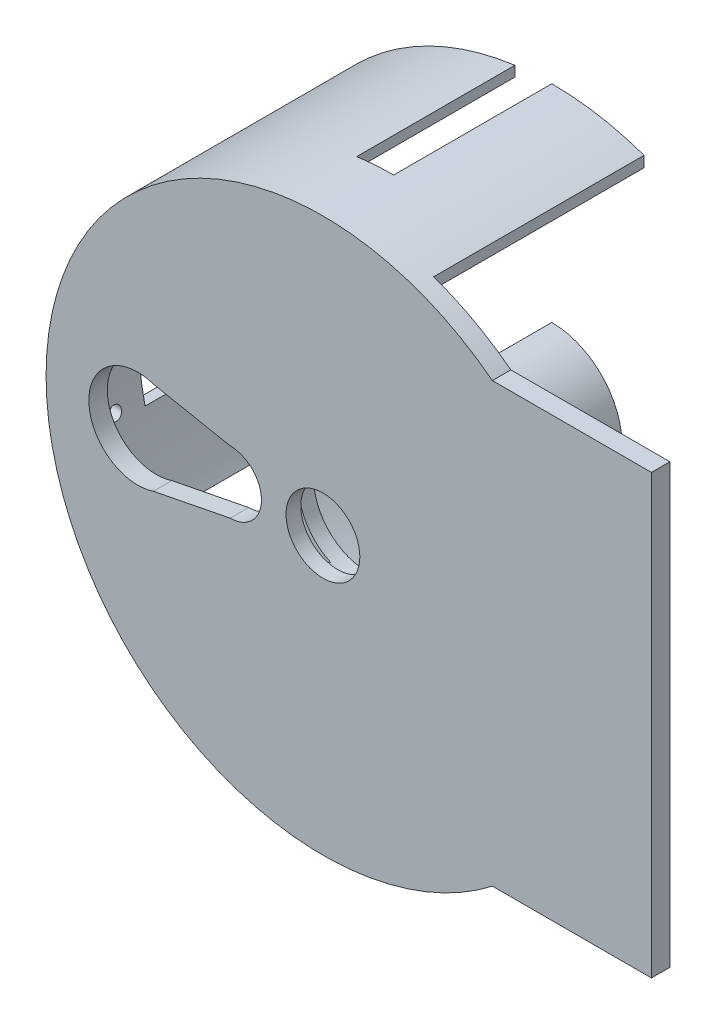
from build123d import *
from build123d.topology import SkipClean

# Parameters (mm, degrees)
SKETCH1_R                = 75
BOSS_EXTRUDE1_DEPTH      = 52
BOSS_EXTRUDE2_DEPTH      = 89
SKETCH6_R                = 67.5
CUT_EXTRUDE1_DEPTH       = 40
SKETCH7_R                = 10
CUT_EXTRUDE2_DEPTH       = 140
BOSS_EXTRUDE3_DEPTH      = 50
SKETCH27_R               = 13.264650289
SKETCH27_R_2             = 8.484923144
CUT_EXTRUDE7_DEPTH       = 32
SKETCH28_W               = 110.347797284
SKETCH28_H               = 32
CUT_EXTRUDE9_DEPTH       = 112
SKETCH30_R               = 1.75
CUT_EXTRUDE10_DEPTH      = 10
SKETCH31_W               = 17.16689537
SKETCH31_H               = 79.570672492
CUT_EXTRUDE11_DEPTH      = 7
SKETCH32_W               = 3
SKETCH32_H               = 75.570672492
CUT_EXTRUDE12_DEPTH      = 8.6
CUT_EXTRUDE13_START      = -8
SKETCH34_R               = 14.5
CUT_EXTRUDE13_DEPTH      = 8
BOSS_EXTRUDE4_START      = 10
SKETCH35_R               = 75
SKETCH35_R_2             = 67.5
BOSS_EXTRUDE4_DEPTH      = 10
SKETCH37_R               = 72.25
SKETCH37_R_2             = 67.5
CUT_EXTRUDE15_DEPTH      = 50
CUT_EXTRUDE16_DEPTH      = 7
CUT_EXTRUDE17_DEPTH      = 7
CUT_EXTRUDE19_REACH      = 184.003
CUT_EXTRUDE19_END_RADIUS = 72.25
SKETCH42_W               = 10
SKETCH42_H               = 42.845008339
CIRPATTERN1_COUNT        = 5
CIRPATTERN1_ANGLE        = 180
CIRPATTERN2_COUNT        = 3
CIRPATTERN2_ANGLE        = 120
CUT_EXTRUDE20_DEPTH      = 10
SKETCH44_W               = 50
SKETCH44_H               = 57
CUT_EXTRUDE21_DEPTH      = 183.002747343


with BuildPart() as part:
    # Sketch1 → Boss-Extrude1 (new body)
    with BuildSketch(Plane.XY):
        Circle(SKETCH1_R)
    extrude(amount=BOSS_EXTRUDE1_DEPTH)

    # Sketch5 → Boss-Extrude2 (add)
    with BuildSketch(Plane(origin=(0, 0, 0), x_dir=(0, 0, -1), z_dir=(1, 0, 0))):
        Polygon((-52, 59.314332163), (-52, 0), (-52, -59.3), (-47, -59.3), (-47, 59.314332163), align=None)
    extrude(amount=BOSS_EXTRUDE2_DEPTH)

    # Sketch6 → Cut-Extrude1 (cut)
    with BuildSketch(Plane(origin=(0, 0, 0), x_dir=(-1, 0, 0), z_dir=(0, 0, -1))):
        Circle(SKETCH6_R)
    extrude(amount=-CUT_EXTRUDE1_DEPTH, mode=Mode.SUBTRACT)

    # Sketch7 → Cut-Extrude2 (cut)
    with BuildSketch(Plane(origin=(0, 0, 40), x_dir=(-1, 0, 0), z_dir=(0, 0, -1))):
        Circle(SKETCH7_R)
    extrude(amount=-CUT_EXTRUDE2_DEPTH, mode=Mode.SUBTRACT)

    # Sketch8 → Boss-Extrude3 (add)
    with BuildSketch(Plane(origin=(0, 0, 40), x_dir=(-1, 0, 0), z_dir=(0, 0, -1))):
        with BuildLine():
            Line((0, 14.5), (0, 19))
            ThreePointArc((0, 19), (-19, 0), (0, -19))
            Line((0, -19), (0, -14.5))
            ThreePointArc((0, -14.5), (-14.5, 0), (0, 14.5))
        make_face()
    extrude(amount=BOSS_EXTRUDE3_DEPTH)

    # Sketch27 → Cut-Extrude7 (cut)
    with BuildSketch(Plane.XY.offset(52)):
        with Locations((-50.154049213, 0)):
            Circle(SKETCH27_R)
        with Locations((-25.142941415, 0)):
            Circle(SKETCH27_R_2)
    extrude(amount=-CUT_EXTRUDE7_DEPTH, mode=Mode.SUBTRACT)

    # Sketch28 → Cut-Extrude9 (cut)
    with BuildSketch(Plane(origin=(0, 0, 0), x_dir=(0, 0, -1), z_dir=(1, 0, 0))):
        with Locations((25.439488733, 0)):
            Rectangle(SKETCH28_W, SKETCH28_H)
    extrude(amount=-CUT_EXTRUDE9_DEPTH, mode=Mode.SUBTRACT)

    # Sketch30 → Cut-Extrude10 (cut)
    with BuildSketch(Plane(origin=(-75, 0, 0), x_dir=(0, 0, -1), z_dir=(1, 0, 0))):
        with Locations(Location((-37.43856487, -14, 0), (0, 0, 180))):
            Circle(SKETCH30_R)
    cut_extrude10 = extrude(amount=CUT_EXTRUDE10_DEPTH, mode=Mode.SUBTRACT)

    # Mirror1: Cut-Extrude10 across plane
    add(cut_extrude10.mirror(Plane.ZX), mode=Mode.SUBTRACT)

    # Sketch31 → Cut-Extrude11 (cut)
    with BuildSketch(Plane(origin=(0, 0, 40), x_dir=(-1, 0, 0), z_dir=(0, 0, -1))):
        with Locations((23.137999933, 1.261486271)):
            Rectangle(SKETCH31_W, SKETCH31_H)
    extrude(amount=-CUT_EXTRUDE11_DEPTH, mode=Mode.SUBTRACT)

    # Sketch32 → Cut-Extrude12 (cut)
    with BuildSketch(Plane.ZY.offset(14.554552248)):
        with Locations((45.5, 1.261486271)):
            Rectangle(SKETCH32_W, SKETCH32_H)
    extrude(amount=-CUT_EXTRUDE12_DEPTH, mode=Mode.SUBTRACT)

    # Sketch34 → Cut-Extrude13 (cut)
    with SkipClean():  # the faces are left unmerged after this step: merging them gives an invalid solid
        with BuildSketch(Plane(origin=(0, 0, 40), x_dir=(-1, 0, 0), z_dir=(0, 0, -1)).offset(CUT_EXTRUDE13_START)):
            with Locations(Location((0, 0, 0), (0, 0, 90))):
                Circle(SKETCH34_R)
        extrude(amount=CUT_EXTRUDE13_DEPTH, mode=Mode.SUBTRACT)

    # Sketch35 → Boss-Extrude4 (add)
    with BuildSketch(Plane(origin=(0, 0, 0), x_dir=(-1, 0, 0), z_dir=(0, 0, -1)).offset(BOSS_EXTRUDE4_START)):
        Circle(SKETCH35_R)
        Circle(SKETCH35_R_2, mode=Mode.SUBTRACT)
    extrude(amount=-BOSS_EXTRUDE4_DEPTH)

    # Sketch37 → Cut-Extrude15 (cut)
    with BuildSketch(Plane(origin=(0, 0, -10), x_dir=(-1, 0, 0), z_dir=(0, 0, -1))):
        Circle(SKETCH37_R)
        Circle(SKETCH37_R_2, mode=Mode.SUBTRACT)
    extrude(amount=-CUT_EXTRUDE15_DEPTH, mode=Mode.SUBTRACT)

    # Sketch38 → Cut-Extrude16 (cut)
    with BuildSketch(Plane(origin=(0, 0, 40), x_dir=(-1, 0, 0), z_dir=(0, 0, -1))):
        with BuildLine():
            Line((0, -23), (68.491331568, -23))
            ThreePointArc((68.491331568, -23), (-72.25, 0), (68.491331568, 23))
            Line((68.491331568, 23), (0, 23))
            ThreePointArc((0, 23), (-23, 0), (0, -23))
        make_face()
    extrude(amount=-CUT_EXTRUDE16_DEPTH, mode=Mode.SUBTRACT)

    # Sketch39 → Cut-Extrude17 (cut)
    with BuildSketch(Plane(origin=(0, 0, 40), x_dir=(-1, 0, 0), z_dir=(0, 0, -1))):
        with BuildLine():
            Line((68.491331568, 23), (31.721447618, 23))
            Line((31.721447618, 23), (31.721447618, -23))
            Line((31.721447618, -23), (68.491331568, -23))
            ThreePointArc((68.491331568, -23), (72.25, 0), (68.491331568, 23))
        make_face()
    extrude(amount=-CUT_EXTRUDE17_DEPTH, mode=Mode.SUBTRACT)

    # Cut-Extrude19: up to this cylinder (the profile starts outside it)
    cut_extrude19_end = Plane(origin=(0, 0, 11.422504), z_dir=(0, 0, -1)) * Cylinder(CUT_EXTRUDE19_END_RADIUS, 513.506, mode=Mode.PRIVATE)
    # Sketch42 → Cut-Extrude19 (cut, up to the surface)
    with BuildSketch(Plane(origin=(0, 75, 0), x_dir=(1, 0, 0), z_dir=(0, 1, 0)), mode=Mode.PRIVATE) as cut_extrude19_sk1:
        with Locations((-5, -11.42250417)):
            Rectangle(SKETCH42_W, SKETCH42_H)
    cut_extrude19_tool1 = extrude(cut_extrude19_sk1.sketch, amount=-CUT_EXTRUDE19_REACH, mode=Mode.PRIVATE) - cut_extrude19_end
    cut_extrude19 = cut_extrude19_tool1.solids().sort_by_distance((-5, 75, 11.422504))[0]
    add(cut_extrude19, mode=Mode.SUBTRACT)

    # CirPattern1: Cut-Extrude19 ×5 about axis
    cirpattern1_axis = Axis((0, 0, 0), (0, 0, -1))
    for i in range(1, CIRPATTERN1_COUNT):
        add(cut_extrude19.rotate(cirpattern1_axis, i * CIRPATTERN1_ANGLE / (CIRPATTERN1_COUNT - 1)), mode=Mode.SUBTRACT)

    # CirPattern2: Cut-Extrude19 ×3 about axis
    cirpattern2_axis = Axis((0, 0, 0), (0, 0, 1))
    for i in range(1, CIRPATTERN2_COUNT):
        add(cut_extrude19.rotate(cirpattern2_axis, i * CIRPATTERN2_ANGLE / (CIRPATTERN2_COUNT - 1)), mode=Mode.SUBTRACT)

    # Sketch43 → Cut-Extrude20 (cut)
    with BuildSketch(Plane.XY.offset(52)):
        Polygon((-45.9, -12.56399668), (-25.142941415, -8.484923144), (-25.142941415, 8.484923144), (-45.9, 12.56399668), align=None)
    extrude(amount=-CUT_EXTRUDE20_DEPTH, mode=Mode.SUBTRACT)

    # Sketch44 → Cut-Extrude21 (cut, through all)
    with SkipClean():  # the faces are left unmerged after this step: merging them gives an invalid solid
        with BuildSketch(Plane(origin=(0, 75, 0), x_dir=(1, 0, 0), z_dir=(0, 1, 0))):
            with Locations((50, -18.5)):
                Rectangle(SKETCH44_W, SKETCH44_H)
        extrude(amount=-CUT_EXTRUDE21_DEPTH, mode=Mode.SUBTRACT)
    add(part.part.scale(1), mode=Mode.REPLACE)  # the faces are merged on a copy


solid = part.part
